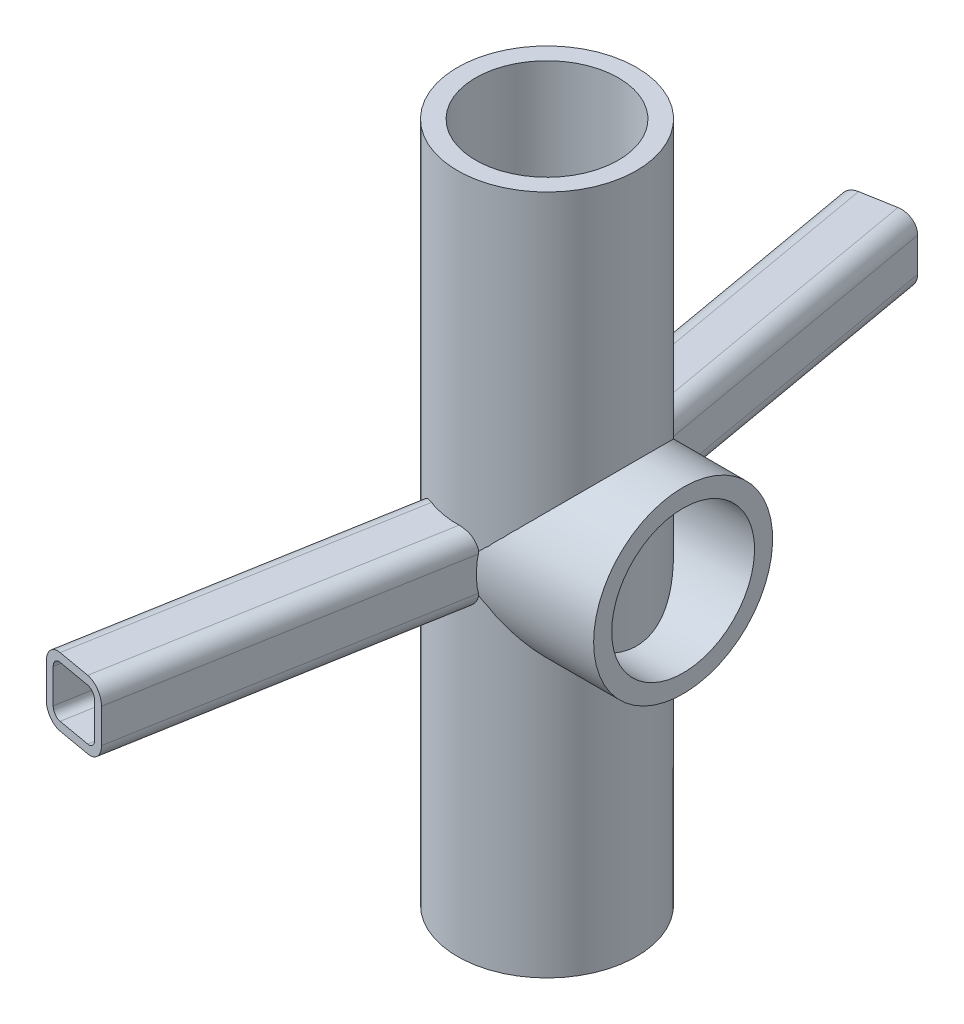
from build123d import *

# Parameters (mm, degrees)
STRUCTURAL_START                 = 51.22286437
STRUCTURAL_MEMBER1_OUTLINE_R     = 16.7005
STRUCTURAL_MEMBER1_OUTLINE_R_2   = 13.3223
STRUCTURAL_MEMBER1_DEPTH         = 25.4000001
STRUCTURAL_START_2               = 134
STRUCTURAL_MEMBER1_2_DEPTH       = 36
STRUCTURAL_START_3               = 88.54231741
STRUCTURAL_MEMBER1_3_OUTLINE_R   = 16.7005
STRUCTURAL_MEMBER1_3_OUTLINE_R_2 = 13.3223
STRUCTURAL_MEMBER1_3_DEPTH       = 127
STRUCTURAL_MEMBER2_DEPTH         = 78.783461448
STRUCTURAL_MEMBER2_2_DEPTH       = 76.2
STRUCTURAL_MEMBER2_2_DEPTH_BACK  = 2.583461448


with BuildPart() as part:
    # Structural Member1: read off the stored shape, not the designer's step
    # Structural Member1 outline → Structural Member1 (new body)
    with BuildSketch(Plane.YZ.offset(STRUCTURAL_START)):
        with Locations((152.04231741, 0)):
            Circle(STRUCTURAL_MEMBER1_OUTLINE_R)
        with Locations((152.04231741, 0)):
            Circle(STRUCTURAL_MEMBER1_OUTLINE_R_2, mode=Mode.SUBTRACT)
    extrude(amount=STRUCTURAL_MEMBER1_DEPTH)

    # Structural Member1 2 outline → Structural Member1 2 (cut)
    with BuildSketch(Plane(origin=(0, 0, 0), x_dir=(1, 0, 0), z_dir=(0, 1, 0)).offset(STRUCTURAL_START_2)):
        with BuildLine():
            ThreePointArc((51.22286447, -16.7005), (67.92336447, 0), (51.22286447, 16.7005))
            Line((51.22286447, 16.7005), (51.22286447, -16.7005))
        make_face()
    extrude(amount=STRUCTURAL_MEMBER1_2_DEPTH, mode=Mode.SUBTRACT)


with BuildPart() as body_2:
    # Structural Member1 3 outline → Structural Member1 3 (new body)
    with BuildSketch(Plane(origin=(0, 0, 0), x_dir=(1, 0, 0), z_dir=(0, 1, 0)).offset(STRUCTURAL_START_3)):
        with Locations((51.22286447, 0)):
            Circle(STRUCTURAL_MEMBER1_3_OUTLINE_R)
        with Locations((51.22286447, 0)):
            Circle(STRUCTURAL_MEMBER1_3_OUTLINE_R_2, mode=Mode.SUBTRACT)
    extrude(amount=STRUCTURAL_MEMBER1_3_DEPTH)


with BuildPart() as body_3:
    # Sketch1 on segment 1 (carried to segment 1) → Structural Member2 (new body)
    with BuildSketch(Plane(origin=(37.990873332, 152.04231741, -75.04235078), x_dir=(0.984807753, 0, -0.173648178), z_dir=(0.173648178, 0, 0.984807753))):
        with BuildLine():
            Line((-3.175, -6.35), (3.175, -6.35))
            ThreePointArc((3.175, -6.35), (5.42006403, -5.42006403), (6.35, -3.175))
            Line((6.35, -3.175), (6.35, 3.175))
            ThreePointArc((6.35, 3.175), (5.42006403, 5.42006403), (3.175, 6.35))
            Line((3.175, 6.35), (-3.175, 6.35))
            ThreePointArc((-3.175, 6.35), (-5.42006403, 5.42006403), (-6.35, 3.175))
            Line((-6.35, 3.175), (-6.35, -3.175))
            ThreePointArc((-6.35, -3.175), (-5.42006403, -5.42006403), (-3.175, -6.35))
        make_face()
        with BuildLine():
            Line((-3.175, -4.7625), (3.175, -4.7625))
            ThreePointArc((3.175, -4.7625), (4.297532015, -4.297532015), (4.7625, -3.175))
            Line((4.7625, -3.175), (4.7625, 3.175))
            ThreePointArc((4.7625, 3.175), (4.297532015, 4.297532015), (3.175, 4.7625))
            Line((3.175, 4.7625), (-3.175, 4.7625))
            ThreePointArc((-3.175, 4.7625), (-4.297532015, 4.297532015), (-4.7625, 3.175))
            Line((-4.7625, 3.175), (-4.7625, -3.175))
            ThreePointArc((-4.7625, -3.175), (-4.297532015, -4.297532015), (-3.175, -4.7625))
        make_face(mode=Mode.SUBTRACT)
    extrude(amount=STRUCTURAL_MEMBER2_DEPTH)

    # Structural Member2 mitre 1
    split(bisect_by=Plane(origin=(51.22286447, 152.04231741, 0), x_dir=(0, 1, 0), z_dir=(0, 0, -1)), keep=Keep.TOP)


with BuildPart() as body_4:
    # Sketch1 → Structural Member2 2 (new, two sides: drawn at the far end of the back side and taken through both)
    with BuildSketch(Plane(origin=(51.22286447, 152.04231741, 0), x_dir=(0.9848077530122076, 0, 0.17364817766693402), z_dir=(-0.17364817766693402, 0, 0.9848077530122076)).offset(-STRUCTURAL_MEMBER2_2_DEPTH_BACK)):
        with BuildLine():
            Line((-3.175, -6.35), (3.175, -6.35))
            ThreePointArc((3.175, -6.35), (5.42006403, -5.42006403), (6.35, -3.175))
            Line((6.35, -3.175), (6.35, 3.175))
            ThreePointArc((6.35, 3.175), (5.42006403, 5.42006403), (3.175, 6.35))
            Line((3.175, 6.35), (-3.175, 6.35))
            ThreePointArc((-3.175, 6.35), (-5.42006403, 5.42006403), (-6.35, 3.175))
            Line((-6.35, 3.175), (-6.35, -3.175))
            ThreePointArc((-6.35, -3.175), (-5.42006403, -5.42006403), (-3.175, -6.35))
        make_face()
        with BuildLine():
            Line((-3.175, -4.7625), (3.175, -4.7625))
            ThreePointArc((3.175, -4.7625), (4.297532015, -4.297532015), (4.7625, -3.175))
            Line((4.7625, -3.175), (4.7625, 3.175))
            ThreePointArc((4.7625, 3.175), (4.297532015, 4.297532015), (3.175, 4.7625))
            Line((3.175, 4.7625), (-3.175, 4.7625))
            ThreePointArc((-3.175, 4.7625), (-4.297532015, 4.297532015), (-4.7625, 3.175))
            Line((-4.7625, 3.175), (-4.7625, -3.175))
            ThreePointArc((-4.7625, -3.175), (-4.297532015, -4.297532015), (-3.175, -4.7625))
        make_face(mode=Mode.SUBTRACT)
    extrude(amount=STRUCTURAL_MEMBER2_2_DEPTH + STRUCTURAL_MEMBER2_2_DEPTH_BACK)

    # Structural Member2 2 mitre 1
    split(bisect_by=Plane(origin=(51.22286447, 152.04231741, 0), x_dir=(0, -1, 0), z_dir=(0, 0, 1)), keep=Keep.TOP)


solid = Compound([part.part, body_2.part, body_3.part, body_4.part])
